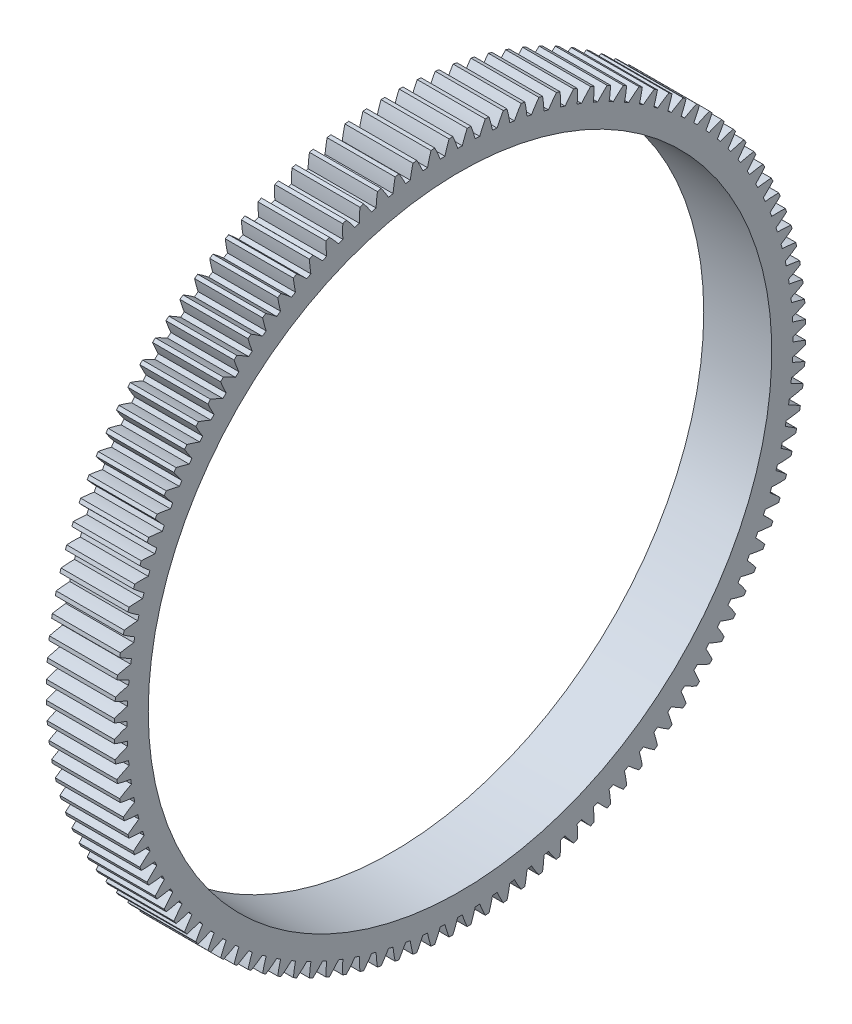
from build123d import *

# Parameters (mm, degrees)
BASPROSKE_W     = 12
BASPROSKE_H     = 61
TOOTHCUT_DEPTH  = 88.097646352
TEETHCUTS_COUNT = 120
TEETHCUTS_ANGLE = 357
BORSKE_R        = 55
BORE_DEPTH      = 50.0000508


with BuildPart() as part:
    # BasProSke → Base-Revolve (revolve)
    with BuildSketch(Plane(origin=(0, 0, 0), x_dir=(1, 0, 0), z_dir=(0, 1, 0))):
        with Locations((6, 30.5)):
            Rectangle(BASPROSKE_W, BASPROSKE_H)
    revolve(axis=Axis((-10, 0, 0), (1, 0, 0)))

    # TooCutSke → ToothCut (cut, through all)
    with BuildSketch(Plane(origin=(0, 0, 0), x_dir=(0, 0, -1), z_dir=(1, 0, 0))):
        with BuildLine():
            ThreePointArc((0.410713273, 58.747564338), (0, 58.749), (-0.410713273, 58.747564338))
            ThreePointArc((-0.410713273, 58.747564338), (-0.812377908, 59.890725701), (-1.271226346, 61.01215804))
            ThreePointArc((-1.271226346, 61.01215804), (0, 61.0254), (1.271226346, 61.01215804))
            ThreePointArc((1.271226346, 61.01215804), (0.812377908, 59.890725701), (0.410713273, 58.747564338))
        make_face()
    toothcut = extrude(amount=TOOTHCUT_DEPTH, mode=Mode.SUBTRACT)

    # TeethCuts: ToothCut ×120 about axis
    teethcuts_axis = Axis((-10, 0, 0), (1, 0, 0))
    for i in range(1, TEETHCUTS_COUNT):
        add(toothcut.rotate(teethcuts_axis, i * TEETHCUTS_ANGLE / (TEETHCUTS_COUNT - 1)), mode=Mode.SUBTRACT)

    # BorSke → Bore (cut, symmetric)
    with BuildSketch(Plane(origin=(0, 0, 0), x_dir=(0, 0, -1), z_dir=(1, 0, 0))):
        Circle(BORSKE_R)
    extrude(amount=BORE_DEPTH, both=True, mode=Mode.SUBTRACT)


solid = part.part
